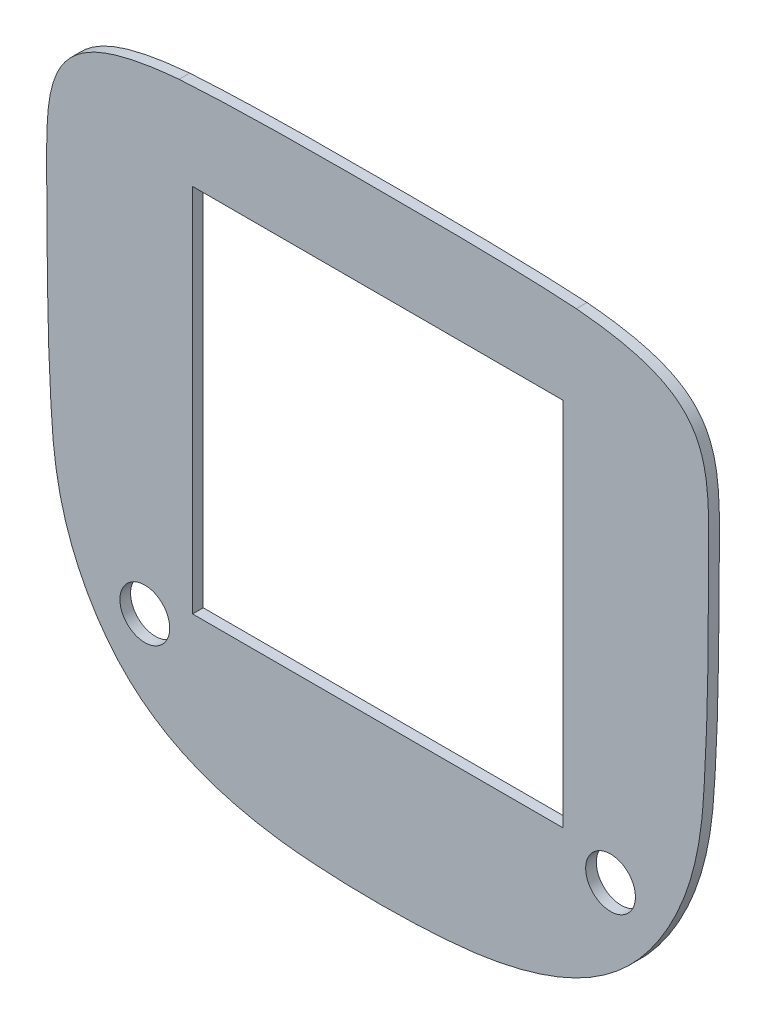
from build123d import *

# Parameters (mm, degrees)
SKETCH1_R           = 7
SKETCH1_R_2         = 7.000000001
SKETCH1_W           = 104.14
SKETCH1_H           = 104.14
BOSS_EXTRUDE1_DEPTH = 3


with BuildPart() as part:
    # Sketch1 → Boss-Extrude1 (new body)
    with BuildSketch(Plane(origin=(0, 0, 100), x_dir=(-1, 0, 0), z_dir=(0, 0, -1))):
        with BuildLine():
            add(Edge.make_bspline(
                [(27.354996181, -67.060879103), (22.810849587, -67.61572874), (18.26167606, -67.986690539), (9.155974583, -68.45958548), (4.599442657, -68.561373141), (-4.5191536, -68.562570158), (-9.081211272, -68.462223125), (-15.929855414, -68.108401377), (-18.213670582, -67.956302347), (-22.783487053, -67.57213436), (-25.072712268, -67.339550598), (-27.354987555, -67.060880265)],
                knots=[0, 0, 0, 0, 0.25, 0.25, 0.5, 0.5, 0.75, 0.75, 0.875, 0.875, 1, 1, 1, 1], degree=3))
            add(Edge.make_bspline(
                [(55.865874118, 104.1311973), (58.25323506, 103.919485239), (60.633299285, 103.660942446), (65.36993385, 102.993071788), (67.726731787, 102.585204653), (71.232870836, 101.786909004), (72.396630414, 101.489019011), (74.711083954, 100.809383177), (75.862791021, 100.427501655), (78.111787638, 99.564492237), (79.212848974, 99.082011708), (80.818526604, 98.258426356), (81.34608153, 97.967213457), (82.383827778, 97.347021517), (82.895823909, 97.016816878), (84.381096706, 95.974954836), (85.307469822, 95.210186162), (86.586467989, 93.941407948), (86.994343068, 93.49817721), (87.771112538, 92.568834315), (88.140266106, 92.081844394), (89.165806708, 90.588282085), (89.748480498, 89.538928359), (90.490153707, 87.894621427), (90.715469177, 87.334884621), (91.12652602, 86.194395624), (91.311285018, 85.615987959), (91.806494684, 83.878547723), (92.06075633, 82.709232951), (92.466986712, 80.355745386), (92.618918736, 79.171567261), (92.851712625, 76.792888086), (92.93262682, 75.598394638), (93.050048202, 73.202957633), (93.085627223, 72.001256128), (93.127022177, 69.599455444), (93.13452068, 68.398603279), (93.128744172, 65.996974774), (93.118023371, 64.79618911), (93.09254292, 61.193807731), (93.079089175, 58.792207247), (93.036967319, 51.587412225), (93.008523986, 46.784216865), (92.858256006, 32.374867812), (92.67642409, 22.768446583), (92.115316937, 10.773329313), (91.98627986, 8.374882137), (91.761241203, 4.780673639), (91.681539526, 3.58304692), (91.511823037, 1.188767393), (91.423288984, -0.00802525), (91.090684332, -3.592075872), (90.789621467, -5.97395185), (90.200214007, -9.533751581), (89.980627701, -10.718097152), (89.495248731, -13.06626012), (89.229115135, -14.231985354), (88.357072081, -17.702912538), (87.677264493, -19.981774772), (86.102628231, -24.462858676), (85.206602939, -26.664653831), (83.7035175, -29.910656822), (83.175745614, -30.983125592), (82.065473035, -33.108555991), (81.4813518, -34.164096071), (79.654958218, -37.28019984), (78.344172747, -39.28325783), (75.519955329, -43.127707362), (74.005553588, -44.968325226), (71.557636189, -47.588592358), (70.712262415, -48.438559085), (68.959694862, -50.089174036), (68.04990556, -50.891594884), (63.410781816, -54.719776185), (59.366533806, -57.235822118), (53.977202375, -59.832620195), (52.882545333, -60.324419636), (50.661134354, -61.255335001), (49.536422344, -61.693559149), (46.142729716, -62.926119647), (43.846612605, -63.641949001), (39.197998952, -64.896241562), (36.845146863, -65.434098403), (32.119484653, -66.355028737), (29.742885871, -66.739227187), (27.354996181, -67.060879103)],
                knots=[0, 0, 0, 0, 0.03125, 0.03125, 0.0625, 0.0625, 0.078125, 0.078125, 0.09375, 0.09375, 0.109375, 0.109375, 0.1171875, 0.1171875, 0.125, 0.125, 0.140625, 0.140625, 0.1484375, 0.1484375, 0.15625, 0.15625, 0.171875, 0.171875, 0.1796875, 0.1796875, 0.1875, 0.1875, 0.203125, 0.203125, 0.21875, 0.21875, 0.234375, 0.234375, 0.25, 0.25, 0.265625, 0.265625, 0.28125, 0.28125, 0.3125, 0.3125, 0.375, 0.375, 0.5, 0.5, 0.53125, 0.53125, 0.546875, 0.546875, 0.5625, 0.5625, 0.59375, 0.59375, 0.609375, 0.609375, 0.625, 0.625, 0.65625, 0.65625, 0.6875, 0.6875, 0.703125, 0.703125, 0.71875, 0.71875, 0.75, 0.75, 0.78125, 0.78125, 0.796875, 0.796875, 0.8125, 0.8125, 0.875, 0.875, 0.890625, 0.890625, 0.90625, 0.90625, 0.9375, 0.9375, 0.96875, 0.96875, 1, 1, 1, 1], degree=3))
            add(Edge.make_bspline(
                [(-55.865874218, 104.131197291), (-51.293318368, 104.426791058), (-46.713806956, 104.633042409), (-37.546798883, 104.942976612), (-32.958514428, 105.045780912), (-23.780900678, 105.190245101), (-19.191870563, 105.231621959), (-10.013567708, 105.280841226), (-5.20917183, 105.288915989), (-0.404721367, 105.28944639), (-0.117888358, 105.289457862), (-0.047586047, 105.289459108), (2.095265646, 105.289447311), (4.164203526, 105.288090763), (8.597564887, 105.280557627), (10.961977574, 105.273732136), (18.055002847, 105.240463329), (22.783409182, 105.201620757), (32.239170083, 105.060705809), (36.966530112, 104.95896183), (46.419434268, 104.64630636), (51.147249043, 104.43623373), (55.865874118, 104.1311973)],
                knots=[0, 0, 0, 0, 0.125, 0.125, 0.25, 0.25, 0.375, 0.375, 0.5, 0.505859375, 0.505859375, 0.5078125, 0.5078125, 0.5625, 0.5625, 0.625, 0.625, 0.75, 0.75, 0.875, 0.875, 1, 1, 1, 1], degree=3))
            add(Edge.make_bspline(
                [(-27.354987555, -67.060880265), (-32.132733032, -66.417311906), (-36.862186688, -65.526376788), (-42.684741105, -63.955474908), (-43.841881664, -63.618960456), (-46.131932137, -62.900307034), (-47.266074456, -62.517838987), (-50.633370608, -61.295733032), (-52.831301237, -60.38119683), (-57.119030907, -58.322194425), (-59.209191741, -57.178497537), (-62.251200118, -55.264702687), (-63.2496146, -54.593624231), (-64.721946217, -53.533229905), (-65.209380763, -53.1700836), (-66.167657422, -52.431364082), (-66.639251655, -52.055309907), (-68.959967385, -50.141979617), (-70.696985038, -48.505225746), (-73.948299187, -45.034081592), (-75.462780611, -43.19985541), (-77.586560121, -40.317236064), (-78.26993027, -39.334572339), (-79.589779893, -37.32763544), (-80.227776249, -36.300663992), (-82.061569923, -33.17842148), (-83.172187966, -31.053175154), (-85.182998949, -26.720417404), (-86.083503659, -24.513027864), (-87.667602871, -20.013448352), (-88.352286816, -17.721684294), (-89.230671608, -14.225927379), (-89.499102732, -13.049318915), (-89.986998715, -10.685535789), (-90.206048276, -9.501090729), (-90.794258511, -5.940685458), (-91.094682017, -3.5576758), (-91.426317095, 0.029042936), (-91.514657674, 1.22689306), (-91.684257683, 3.623319525), (-91.76395141, 4.82205644), (-91.988842587, 8.419722463), (-92.117754717, 10.820448481), (-92.678420073, 22.831358799), (-92.859519757, 32.448117676), (-93.009212958, 46.874567517), (-93.037534722, 51.683354172), (-93.079695754, 58.896533707), (-93.093255898, 61.300926201), (-93.118834804, 64.907522215), (-93.129614171, 66.109724014), (-93.13414069, 68.514103965), (-93.125913923, 69.716279374), (-93.082572133, 72.120592858), (-93.045713751, 73.322728512), (-92.92462249, 75.72693404), (-92.84105985, 76.930813237), (-92.600704592, 79.324847731), (-92.444071297, 80.515672957), (-92.025972761, 82.879517624), (-91.764392204, 84.05251748), (-91.256354676, 85.792371191), (-91.068219843, 86.36699017), (-90.652807731, 87.494196584), (-90.42514299, 88.048176521), (-89.675289617, 89.677879563), (-89.085812693, 90.721158979), (-88.045055936, 92.2106002), (-87.67505807, 92.690115503), (-86.898373027, 93.604834331), (-86.490397246, 94.041807462), (-85.210313494, 95.294416603), (-84.282139076, 96.05183577), (-82.791406704, 97.085716987), (-82.28186919, 97.410712775), (-81.248526963, 98.02216714), (-80.72340151, 98.309364768), (-79.125617827, 99.121847036), (-78.030625017, 99.598180501), (-75.794991188, 100.450799283), (-74.651796989, 100.828183594), (-72.343095495, 101.50327884), (-71.182475696, 101.799250612), (-67.686358399, 102.592608648), (-65.337028385, 102.998258772), (-60.616238408, 103.662794946), (-58.244563311, 103.920254251), (-55.865874218, 104.131197291)],
                knots=[0, 0, 0, 0, 0.0625, 0.0625, 0.078125, 0.078125, 0.09375, 0.09375, 0.125, 0.125, 0.15625, 0.15625, 0.171875, 0.171875, 0.1796875, 0.1796875, 0.1875, 0.1875, 0.21875, 0.21875, 0.25, 0.25, 0.265625, 0.265625, 0.28125, 0.28125, 0.3125, 0.3125, 0.34375, 0.34375, 0.375, 0.375, 0.390625, 0.390625, 0.40625, 0.40625, 0.4375, 0.4375, 0.453125, 0.453125, 0.46875, 0.46875, 0.5, 0.5, 0.625, 0.625, 0.6875, 0.6875, 0.71875, 0.71875, 0.734375, 0.734375, 0.75, 0.75, 0.765625, 0.765625, 0.78125, 0.78125, 0.796875, 0.796875, 0.8125, 0.8125, 0.8203125, 0.8203125, 0.828125, 0.828125, 0.84375, 0.84375, 0.8515625, 0.8515625, 0.859375, 0.859375, 0.875, 0.875, 0.8828125, 0.8828125, 0.890625, 0.890625, 0.90625, 0.90625, 0.921875, 0.921875, 0.9375, 0.9375, 0.96875, 0.96875, 1, 1, 1, 1], degree=3))
        make_face()
        with Locations((-65.5, -30.887752409)):
            Circle(SKETCH1_R, mode=Mode.SUBTRACT)
        with Locations((65.5, -30.887752409)):
            Circle(SKETCH1_R_2, mode=Mode.SUBTRACT)
        with Locations((0, 27.871196428)):
            Rectangle(SKETCH1_W, SKETCH1_H, mode=Mode.SUBTRACT)
    extrude(amount=BOSS_EXTRUDE1_DEPTH)


solid = part.part
